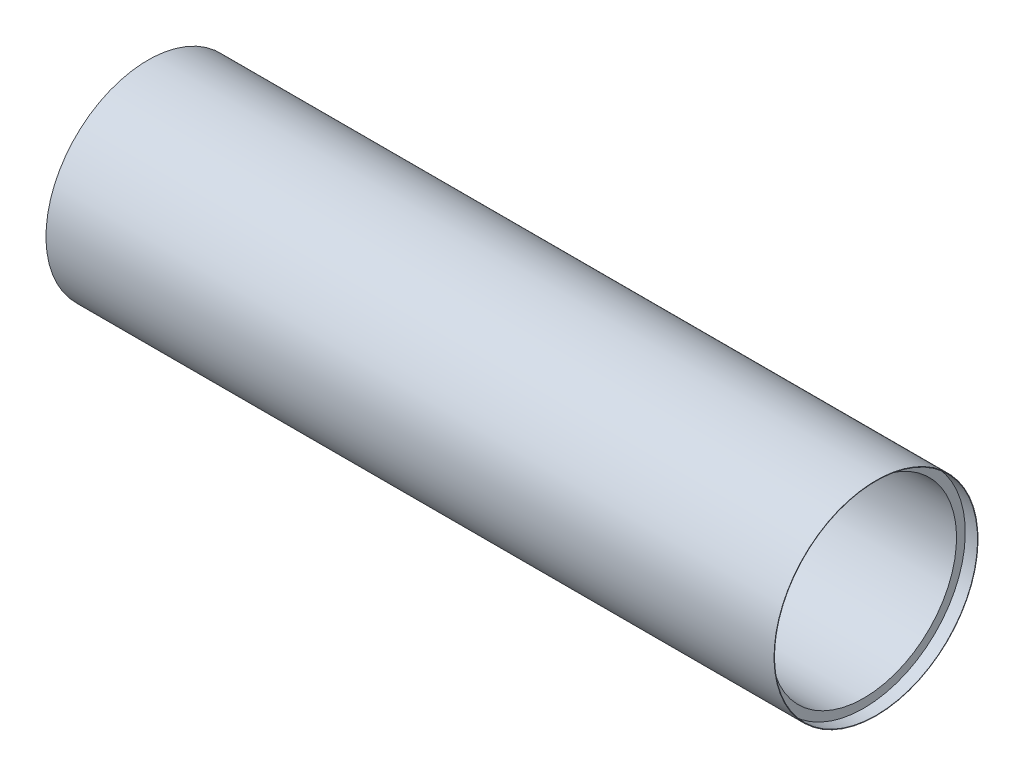
from build123d import *


with BuildPart() as part:
    # Sketch1 → Revolve1 (revolve)
    with BuildSketch(Plane.XY):
        Polygon((39.146309032, 84.3534), (39.146309032, 83.9724), (49.306309032, 83.9724), (49.306309032, 76.7334), (631.042509032, 76.7334), (631.042509032, 83.9724), (641.202509032, 83.9724), (641.202509032, 84.3534), align=None)
    revolve(axis=Axis((0, 0, 0), (1, 0, 0)))


solid = part.part
